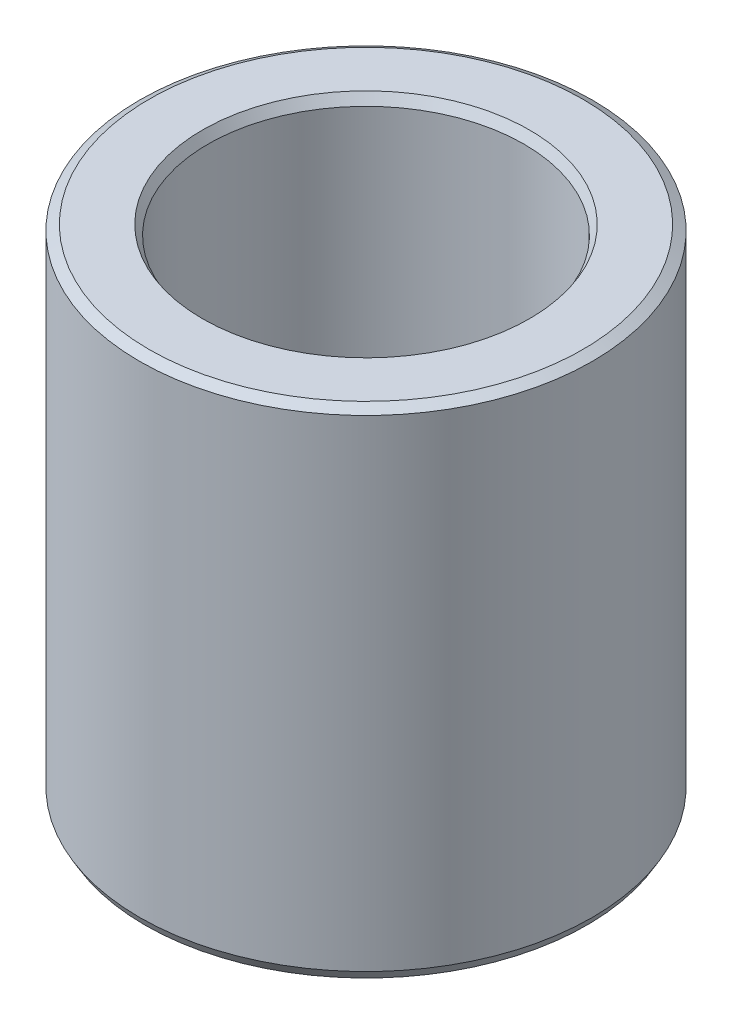
from build123d import *
from OCP.BRepFilletAPI import BRepFilletAPI_MakeChamfer

# Parameters (mm, degrees)
SKETCH1_R           = 35
BOSS_EXTRUDE1_DEPTH = 76.783560248
SKETCH2_R           = 24.436205532
CUT_EXTRUDE1_DEPTH  = 92.354885607
CHAMFER1_SIZE       = 0.849310313
CHAMFER1_SIZE2      = 1.471048614


with BuildPart() as part:
    # Sketch1 → Boss-Extrude1 (new body)
    with BuildSketch(Plane(origin=(0, 0, 0), x_dir=(1, 0, 0), z_dir=(0, 1, 0))):
        Circle(SKETCH1_R)
    extrude(amount=BOSS_EXTRUDE1_DEPTH)

    # Sketch2 → Cut-Extrude1 (cut, through all)
    with BuildSketch(Plane(origin=(0, 0, 0), x_dir=(1, 0, 0), z_dir=(0, 1, 0))):
        Circle(SKETCH2_R)
    extrude(amount=CUT_EXTRUDE1_DEPTH, mode=Mode.SUBTRACT)

    # Chamfer1: one chamfer whose edges measure the first distance from different faces: ONE call of the kernel's chamfer builder (chamfer() names one face for all edges)
    chamfer1_edges_1 = [part.edges().sort_by_distance(p)[0] for p in [
        (-24.436205532, 76.783560248, 0),
    ]]
    chamfer1_side_1 = [part.faces().sort_by_distance(p)[0] for p in [
        (-34.010050506, 76.783560248, 0),
    ]]
    chamfer1_edges_2 = [part.edges().sort_by_distance(p)[0] for p in [
        (-24.436205532, 0, 0),
    ]]
    chamfer1_side_2 = [part.faces().sort_by_distance(p)[0] for p in [
        (-24.436205532, 38.391780124, 0),
    ]]
    chamfer1_edges_3 = [part.edges().sort_by_distance(p)[0] for p in [
        (-35, 0, 0),
    ]]
    chamfer1_side_3 = [part.faces().sort_by_distance(p)[0] for p in [
        (-34.010050506, 0, 0),
    ]]
    chamfer1_edges_4 = [part.edges().sort_by_distance(p)[0] for p in [
        (-35, 76.783560248, 0),
    ]]
    chamfer1_side_4 = [part.faces().sort_by_distance(p)[0] for p in [
        (-35, 38.391780124, 0),
    ]]
    chamfer1 = BRepFilletAPI_MakeChamfer(part.part.solid().wrapped)
    for e in chamfer1_edges_1:
        chamfer1.Add(CHAMFER1_SIZE, CHAMFER1_SIZE2, e.wrapped, chamfer1_side_1[0].wrapped)  # the first distance lies on this face
    for e in chamfer1_edges_2:
        chamfer1.Add(CHAMFER1_SIZE, CHAMFER1_SIZE2, e.wrapped, chamfer1_side_2[0].wrapped)  # the first distance lies on this face
    for e in chamfer1_edges_3:
        chamfer1.Add(CHAMFER1_SIZE, CHAMFER1_SIZE2, e.wrapped, chamfer1_side_3[0].wrapped)  # the first distance lies on this face
    for e in chamfer1_edges_4:
        chamfer1.Add(CHAMFER1_SIZE, CHAMFER1_SIZE2, e.wrapped, chamfer1_side_4[0].wrapped)  # the first distance lies on this face
    add(Compound.cast(chamfer1.Shape()), mode=Mode.REPLACE)


solid = part.part
